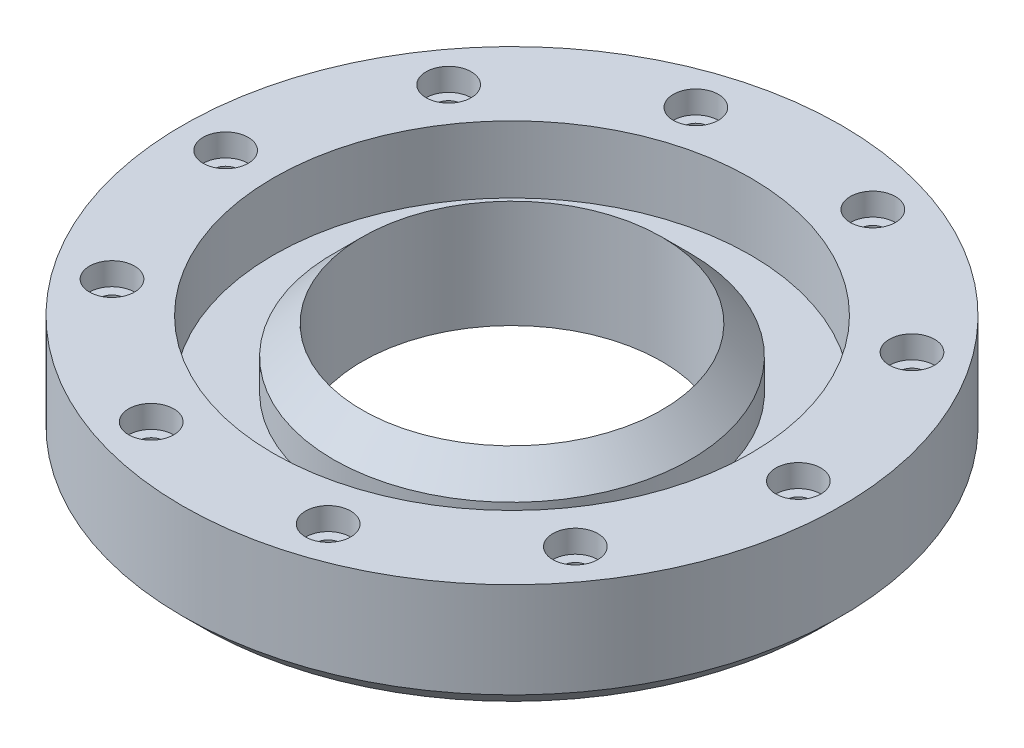
from build123d import *

# Parameters (mm, degrees)
CHAMFER2_SIZE     = 3.81
HOLE1_D           = 6
HOLE1_DEPTH       = 3
CIRPATTERN1_COUNT = 10
CHAMFER3_SIZE     = 2.54


with BuildPart() as part:
    # Sketch1 → Revolve1 (revolve)
    with BuildSketch(Plane.XY, mode=Mode.PRIVATE) as revolve1_sk:
        Polygon((19.939, 0), (43.84802, 0), (43.84802, 15.24), (31.75, 15.24), (31.75, 6.35), (23.749, 6.35), (23.749, 14.33322), (19.939, 14.33322), align=None)
    revolve(revolve1_sk.sketch.rotate(Axis((0, 0, 0), (0, 1, 0)), 90), axis=Axis((0, 0, 0), (0, 1, 0)))

    # Chamfer2
    chamfer2_edges = [part.edges().sort_by_distance(p)[0] for p in [
        (0, 14.33322, 23.749),
    ]]
    chamfer(chamfer2_edges, length=CHAMFER2_SIZE - 0.0001)  # a hair under: the kernel refuses the full size

    # Hole1
    with Locations(Plane(origin=(0, 15.24, 0), x_dir=(1, 0, 0), z_dir=(0, 1, 0))):
        with Locations((38.1, 0)):
            hole1 = Hole(HOLE1_D / 2, depth=HOLE1_DEPTH)

    # Sketch5 → M4x0.7 Tapped Hole1 (revolve, cut)
    with BuildSketch(Plane(origin=(38.1, 12.24, 0), x_dir=(0, 0, 1), z_dir=(1, 0, 0))):
        Polygon((0, 0), (0, 8.991429421), (1.65, 8.0000094), (1.65, 0), align=None)
    m4x0_7_tapped_hole1 = revolve(axis=Axis((38.1, 18.59, 0), (0, -1, 0)), mode=Mode.SUBTRACT)

    # CirPattern1: Hole1, M4x0.7 Tapped Hole1 ×10 about axis
    cirpattern1_axis = Axis((0, 0, 0), (0, 1, 0))
    add([hole1.rotate(cirpattern1_axis, i * 360 / CIRPATTERN1_COUNT) for i in range(1, CIRPATTERN1_COUNT)], mode=Mode.SUBTRACT)
    add([m4x0_7_tapped_hole1.rotate(cirpattern1_axis, i * 360 / CIRPATTERN1_COUNT) for i in range(1, CIRPATTERN1_COUNT)], mode=Mode.SUBTRACT)

    # Chamfer3
    chamfer3_edges = [part.edges().sort_by_distance(p)[0] for p in [
        (0, 0, 43.84802),
    ]]
    chamfer(chamfer3_edges, length=CHAMFER3_SIZE)


solid = part.part
